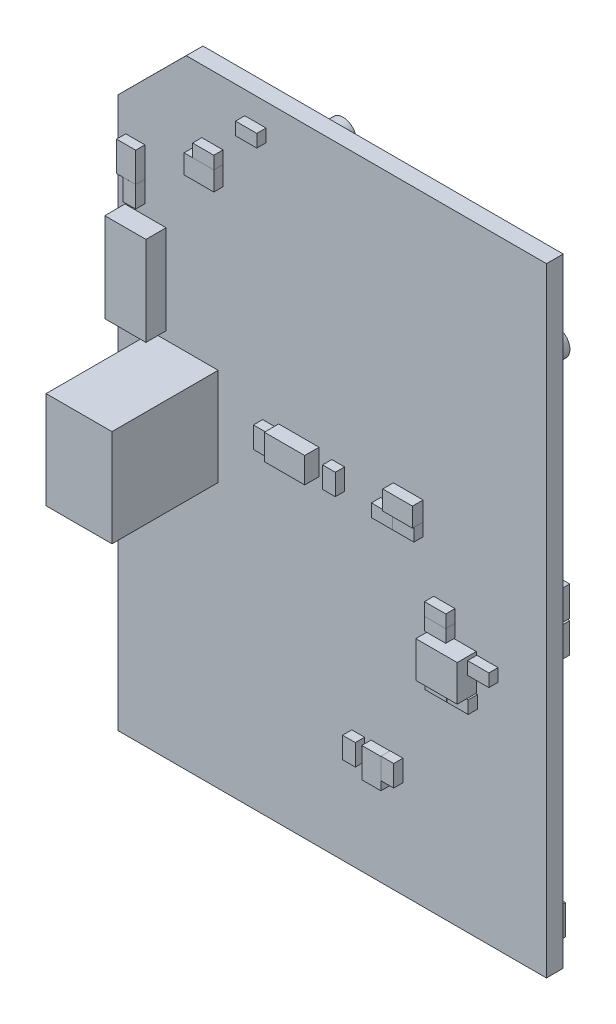
from build123d import *

# Parameters (mm, degrees)
BOARD_DEPTH            = 1.5748
ESQUISSE2_R            = 1.25
TMR16_1_DEPTH          = 2.5
ESQUISSE3_W            = 2.8
ESQUISSE3_H            = 1.8
EXTRUDE_C0603_1_DEPTH  = 0.87
ESQUISSE4_W            = 1.8
ESQUISSE4_H            = 2.8
EXTRUDE_R0603_1_DEPTH  = 0.87
ESQUISSE5_W            = 3.8
ESQUISSE5_H            = 2.4
EXTRUDE_C0805_1_DEPTH  = 1.35
ESQUISSE6_W            = 1.8
ESQUISSE6_H            = 2.8
EXTRUDE_R0603_2_DEPTH  = 0.87
ESQUISSE7_W            = 6.2
ESQUISSE7_H            = 9.15
B2B_PH_SM4_TB_1_DEPTH  = 10
ESQUISSE8_W            = 2.8
ESQUISSE8_H            = 1.8
EXTRUDE_C0603_2_DEPTH  = 0.87
ESQUISSE9_W            = 1.2
ESQUISSE9_H            = 2
EXTRUDE_C0402_1_DEPTH  = 0.87
ESQUISSE10_W           = 1.2
ESQUISSE10_H           = 2
EXTRUDE_C0402_2_DEPTH  = 0.87
ESQUISSE11_W           = 1.2
ESQUISSE11_H           = 2
EXTRUDE_C0402_3_DEPTH  = 0.87
ESQUISSE12_W           = 1.8
ESQUISSE12_H           = 2.8
EXTRUDE_R0603_3_DEPTH  = 0.87
ESQUISSE13_W           = 1.8
ESQUISSE13_H           = 2.8
EXTRUDE_R0603_4_DEPTH  = 0.87
ESQUISSE14_W           = 3.87388
ESQUISSE14_H           = 8.4
PCM12SMTR_1_DEPTH      = 1.9
ESQUISSE17_W           = 1.2
ESQUISSE17_H           = 2
EXTRUDE_C0402_4_DEPTH  = 0.87
ESQUISSE18_W           = 4.2
ESQUISSE18_H           = 2.5
FC135_1_DEPTH          = 0.8
ESQUISSE19_W           = 2.8
ESQUISSE19_H           = 1.8
EXTRUDE_C0603_3_DEPTH  = 0.87
ESQUISSE20_W           = 2
ESQUISSE20_H           = 1.2
EXTRUDE_C0402_5_DEPTH  = 0.87
ESQUISSE21_W           = 1.2
ESQUISSE21_H           = 2
EXTRUDE_R0402_1_DEPTH  = 0.87
ESQUISSE22_W           = 1.2
ESQUISSE22_H           = 2
EXTRUDE_R0402_2_DEPTH  = 0.87
ESQUISSE24_W           = 1.2
ESQUISSE24_H           = 2
EXTRUDE_C0402_6_DEPTH  = 0.87
ESQUISSE25_W           = 2
ESQUISSE25_H           = 1.2
EXTRUDE_C0402_7_DEPTH  = 0.87
ESQUISSE26_W           = 1.8
ESQUISSE26_H           = 2.8
EXTRUDE_C0603_4_DEPTH  = 0.87
ESQUISSE27_W           = 2
ESQUISSE27_H           = 1.2
EXTRUDE_C0402_8_DEPTH  = 0.87
ESQUISSE28_W           = 1.2
ESQUISSE28_H           = 2
EXTRUDE_C0402_9_DEPTH  = 0.87
ESQUISSE29_W           = 2.8
ESQUISSE29_H           = 1.8
EXTRUDE_R0603_5_DEPTH  = 0.87
ESQUISSE30_R           = 1.25
TMR16_2_DEPTH          = 2.5
ESQUISSE31_W           = 1.2
ESQUISSE31_H           = 2
EXTRUDE_C0402_10_DEPTH = 0.87
ESQUISSE33_W           = 2
ESQUISSE33_H           = 1.2
EXTRUDE_C0402_11_DEPTH = 0.87
ESQUISSE34_W           = 1.2
ESQUISSE34_H           = 2
EXTRUDE_C0402_12_DEPTH = 0.87
ESQUISSE36_W           = 1.2
ESQUISSE36_H           = 2
EXTRUDE_R0402_3_DEPTH  = 0.87
ESQUISSE37_W           = 1.2
ESQUISSE37_H           = 2
EXTRUDE_R0402_4_DEPTH  = 0.87
ESQUISSE38_W           = 2.8
ESQUISSE38_H           = 1.8
EXTRUDE_D0603_1_DEPTH  = 1
ESQUISSE39_W           = 1
ESQUISSE39_H           = 1
PAD_1X1_1_DEPTH        = 2.54
ESQUISSE40_W           = 2
ESQUISSE40_H           = 1.2
EXTRUDE_C0402_13_DEPTH = 0.87
ESQUISSE41_W           = 2
ESQUISSE41_H           = 1.2
EXTRUDE_R0402_5_DEPTH  = 0.87
ESQUISSE42_W           = 2
ESQUISSE42_H           = 1.2
EXTRUDE_C0402_14_DEPTH = 0.87
ESQUISSE43_W           = 1.2
ESQUISSE43_H           = 2
EXTRUDE_R0402_6_DEPTH  = 0.87
ESQUISSE44_W           = 1.8
ESQUISSE44_H           = 2.8
EXTRUDE_C0603_5_DEPTH  = 0.87
ESQUISSE45_W           = 2.8
ESQUISSE45_H           = 1.8
EXTRUDE_R0603_6_DEPTH  = 0.87
ESQUISSE46_W           = 2.8
ESQUISSE46_H           = 1.8
EXTRUDE_R0603_7_DEPTH  = 0.87
ESQUISSE47_W           = 1.2
ESQUISSE47_H           = 2
EXTRUDE_R0402_7_DEPTH  = 0.87
ESQUISSE48_W           = 1.8
ESQUISSE48_H           = 2.8
EXTRUDE_C0603_6_DEPTH  = 0.87
ESQUISSE49_W           = 1.8
ESQUISSE49_H           = 2.8
EXTRUDE_C0603_7_DEPTH  = 0.87
ESQUISSE52_W           = 1.8
ESQUISSE52_H           = 2.8
EXTRUDE_C0603_8_DEPTH  = 0.87
ESQUISSE53_W           = 1.2
ESQUISSE53_H           = 2
EXTRUDE_C0402_15_DEPTH = 0.87
ESQUISSE54_W           = 2
ESQUISSE54_H           = 1.2
EXTRUDE_C0402_16_DEPTH = 0.87
ESQUISSE55_W           = 3.9
ESQUISSE55_H           = 3.4
NX2520_1_DEPTH         = 1.8
ESQUISSE56_W           = 2
ESQUISSE56_H           = 1.2
EXTRUDE_C0402_17_DEPTH = 0.87
ESQUISSE57_W           = 1.8
ESQUISSE57_H           = 2.8
EXTRUDE_C0603_9_DEPTH  = 0.87
ESQUISSE59_W           = 1.2
ESQUISSE59_H           = 2
EXTRUDE_R0402_8_DEPTH  = 0.87
ESQUISSE60_W           = 1.2
ESQUISSE60_H           = 2
EXTRUDE_C0402_18_DEPTH = 0.87
ESQUISSE61_W           = 1.2
ESQUISSE61_H           = 2
EXTRUDE_C0402_19_DEPTH = 0.87
ESQUISSE63_W           = 2.8
ESQUISSE63_H           = 1.8
EXTRUDE_R0603_8_DEPTH  = 0.87
ESQUISSE64_W           = 2
ESQUISSE64_H           = 1.2
EXTRUDE_C0402_20_DEPTH = 0.87
ESQUISSE65_W           = 1.2
ESQUISSE65_H           = 2
EXTRUDE_R0402_9_DEPTH  = 0.87
ESQUISSE66_W           = 1.2
ESQUISSE66_H           = 2
EXTRUDE_R0402_10_DEPTH = 0.87
ESQUISSE69_W           = 1
ESQUISSE69_H           = 1
PAD_1X1_2_DEPTH        = 2.54
ESQUISSE70_W           = 1.8
ESQUISSE70_H           = 2.8
EXTRUDE_R0603_9_DEPTH  = 0.87
ESQUISSE72_W           = 2
ESQUISSE72_H           = 1.2
EXTRUDE_C0402_21_DEPTH = 0.87
ESQUISSE73_W           = 1.8
ESQUISSE73_H           = 2.8
EXTRUDE_C0603_10_DEPTH = 0.87
ESQUISSE74_W           = 1.2
ESQUISSE74_H           = 2
EXTRUDE_R0402_11_DEPTH = 0.87
ESQUISSE76_W           = 1.8
ESQUISSE76_H           = 2.8
EXTRUDE_C0603_11_DEPTH = 0.87
ESQUISSE77_W           = 2
ESQUISSE77_H           = 1.2
EXTRUDE_C0402_22_DEPTH = 0.87
ESQUISSE78_W           = 1.2
ESQUISSE78_H           = 2
EXTRUDE_C0402_23_DEPTH = 0.87
ESQUISSE80_W           = 2.8
ESQUISSE80_H           = 1.8
EXTRUDE_R0603_10_DEPTH = 0.87
ESQUISSE81_R           = 1.25
TMR16_3_DEPTH          = 2.5
ESQUISSE82_W           = 2
ESQUISSE82_H           = 1.2
EXTRUDE_C0402_24_DEPTH = 0.87
ESQUISSE85_W           = 1.2
ESQUISSE85_H           = 2
EXTRUDE_C0402_25_DEPTH = 0.87
ESQUISSE86_W           = 3.4
ESQUISSE86_H           = 3.9
NX2520_2_DEPTH         = 1.8
ESQUISSE88_W           = 1.8
ESQUISSE88_H           = 2.8
EXTRUDE_C0603_12_DEPTH = 0.87
ESQUISSE89_W           = 2.8
ESQUISSE89_H           = 1.8
EXTRUDE_R0603_11_DEPTH = 0.87
ESQUISSE90_W           = 2
ESQUISSE90_H           = 1.2
EXTRUDE_C0402_26_DEPTH = 0.87
ESQUISSE91_W           = 1.2
ESQUISSE91_H           = 2
EXTRUDE_C0402_27_DEPTH = 0.87
ESQUISSE92_W           = 2
ESQUISSE92_H           = 1.2
EXTRUDE_C0402_28_DEPTH = 0.87
ESQUISSE93_W           = 1.2
ESQUISSE93_H           = 2
EXTRUDE_R0402_12_DEPTH = 0.87
ESQUISSE94_W           = 1.2
ESQUISSE94_H           = 2
EXTRUDE_C0402_29_DEPTH = 0.87
ESQUISSE95_W           = 3.8
ESQUISSE95_H           = 2.4
EXTRUDE_C0805_2_DEPTH  = 1.35
ESQUISSE96_W           = 2.8
ESQUISSE96_H           = 1.8
EXTRUDE_R0603_12_DEPTH = 0.87
ESQUISSE97_W           = 1.2
ESQUISSE97_H           = 2
EXTRUDE_C0402_30_DEPTH = 0.87
ESQUISSE99_W           = 1.8
ESQUISSE99_H           = 2.8
EXTRUDE_D0603_2_DEPTH  = 1
ESQUISSE100_W          = 5.2
ESQUISSE100_H          = 3.6
F_2450AT18A100_1_DEPTH = 1.3
ESQUISSE101_W          = 1.2
ESQUISSE101_H          = 2
EXTRUDE_C0402_31_DEPTH = 0.87
ESQUISSE102_W          = 1.8
ESQUISSE102_H          = 2.8
EXTRUDE_R0603_13_DEPTH = 0.87
ESQUISSE104_R          = 1.25
TMR16_4_DEPTH          = 2.5
ESQUISSE105_W          = 1.2
ESQUISSE105_H          = 2
EXTRUDE_C0402_32_DEPTH = 0.87
ESQUISSE106_W          = 2.8
ESQUISSE106_H          = 1.8
EXTRUDE_C0603_13_DEPTH = 0.87
ESQUISSE107_W          = 2.4
ESQUISSE107_H          = 3.8
EXTRUDE_C0805_3_DEPTH  = 1.35
ESQUISSE108_W          = 1.2
ESQUISSE108_H          = 2
EXTRUDE_R0402_13_DEPTH = 0.87
ESQUISSE109_W          = 2
ESQUISSE109_H          = 1.2
EXTRUDE_R0402_14_DEPTH = 0.87
ESQUISSE110_W          = 1.2
ESQUISSE110_H          = 2
EXTRUDE_R0402_15_DEPTH = 0.87
ESQUISSE111_W          = 2
ESQUISSE111_H          = 1.2
EXTRUDE_R0402_16_DEPTH = 0.87
ESQUISSE114_W          = 2
ESQUISSE114_H          = 1.2
EXTRUDE_C0402_33_DEPTH = 0.87
ESQUISSE115_W          = 1.2
ESQUISSE115_H          = 2
EXTRUDE_C0402_34_DEPTH = 0.87
ESQUISSE116_W          = 1.8
ESQUISSE116_H          = 2.8
EXTRUDE_C0603_14_DEPTH = 0.87
ESQUISSE117_W          = 1.2
ESQUISSE117_H          = 2
EXTRUDE_C0402_35_DEPTH = 0.87
ESQUISSE118_R          = 1.25
TMR16_5_DEPTH          = 2.5
ESQUISSE119_W          = 2
ESQUISSE119_H          = 1.2
EXTRUDE_C0402_36_DEPTH = 0.87
ESQUISSE120_W          = 2.8
ESQUISSE120_H          = 1.8
EXTRUDE_C0603_15_DEPTH = 0.87
ESQUISSE122_W          = 1.2
ESQUISSE122_H          = 2
EXTRUDE_C0402_37_DEPTH = 0.87
ESQUISSE123_W          = 2
ESQUISSE123_H          = 1.2
EXTRUDE_C0402_38_DEPTH = 0.87
ESQUISSE124_W          = 2.8
ESQUISSE124_H          = 1.8
EXTRUDE_C0603_16_DEPTH = 0.87
ESQUISSE125_W          = 2
ESQUISSE125_H          = 1.2
EXTRUDE_C0402_39_DEPTH = 0.87
ESQUISSE126_W          = 1.2
ESQUISSE126_H          = 2
EXTRUDE_R0402_17_DEPTH = 0.87
ESQUISSE127_W          = 1.2
ESQUISSE127_H          = 2
EXTRUDE_C0402_40_DEPTH = 0.87
ESQUISSE128_R          = 1.25
TMR16_6_DEPTH          = 2.5
ESQUISSE129_W          = 2.8
ESQUISSE129_H          = 1.8
EXTRUDE_C0603_17_DEPTH = 0.87
ESQUISSE130_W          = 1.8
ESQUISSE130_H          = 2.8
EXTRUDE_C0603_18_DEPTH = 0.87
ESQUISSE131_W          = 1.8
ESQUISSE131_H          = 2.8
EXTRUDE_C0603_19_DEPTH = 0.87
ESQUISSE132_W          = 1.2
ESQUISSE132_H          = 2
EXTRUDE_R0402_18_DEPTH = 0.87
ESQUISSE133_W          = 1.2
ESQUISSE133_H          = 2
EXTRUDE_C0402_41_DEPTH = 0.87
ESQUISSE134_W          = 2
ESQUISSE134_H          = 1.2
EXTRUDE_C0402_42_DEPTH = 0.87
ESQUISSE135_W          = 1.8
ESQUISSE135_H          = 2.8
EXTRUDE_C0603_20_DEPTH = 0.87


with BuildPart() as part:
    # Esquisse1 → BOARD (new body)
    with BuildSketch(Plane.XY):
        Polygon((0, 0), (40.32, 0), (40.32, 58.24), (6.406017, 58.24), (0, 51.854002), align=None)
    extrude(amount=BOARD_DEPTH)


with BuildPart() as body_2:
    # Esquisse2 → TMR16-1 (new body)
    with BuildSketch(Plane.XY):
        with Locations((32.203899, 48.279009)):
            Circle(ESQUISSE2_R)
    extrude(amount=-TMR16_1_DEPTH)


with BuildPart() as body_3:
    # Esquisse3 → Extrude C0603-1 (new body)
    with BuildSketch(Plane.XY):
        with Locations((25.872733, 3.808157)):
            Rectangle(ESQUISSE3_W, ESQUISSE3_H)
    extrude(amount=-EXTRUDE_C0603_1_DEPTH)


with BuildPart() as body_4:
    # Esquisse4 → Extrude R0603-1 (new body)
    with BuildSketch(Plane.XY):
        with Locations((22.308877, 43.200925)):
            Rectangle(ESQUISSE4_W, ESQUISSE4_H)
    extrude(amount=-EXTRUDE_R0603_1_DEPTH)


with BuildPart() as body_5:
    # Esquisse5 → Extrude C0805-1 (new body)
    with BuildSketch(Plane.XY.offset(1.5748)):
        with Locations((17.009653, 31.367792)):
            Rectangle(ESQUISSE5_W, ESQUISSE5_H)
    extrude(amount=EXTRUDE_C0805_1_DEPTH)


with BuildPart() as body_6:
    # Esquisse6 → Extrude R0603-2 (new body)
    with BuildSketch(Plane.XY):
        with Locations((11.818698, 46.124731)):
            Rectangle(ESQUISSE6_W, ESQUISSE6_H)
    extrude(amount=-EXTRUDE_R0603_2_DEPTH)


with BuildPart() as body_7:
    # Esquisse7 → B2B-PH-SM4-TB-1 (new body)
    with BuildSketch(Plane.XY.offset(1.5748)):
        with Locations((6.316633, 29.518179)):
            Rectangle(ESQUISSE7_W, ESQUISSE7_H)
    extrude(amount=B2B_PH_SM4_TB_1_DEPTH)


with BuildPart() as body_8:
    # Esquisse8 → Extrude C0603-2 (new body)
    with BuildSketch(Plane.XY):
        with Locations((15.820005, 23.944537)):
            Rectangle(ESQUISSE8_W, ESQUISSE8_H)
    extrude(amount=-EXTRUDE_C0603_2_DEPTH)


with BuildPart() as body_9:
    # Esquisse9 → Extrude C0402-1 (new body)
    with BuildSketch(Plane.XY):
        with Locations((10.567667, 31.517398)):
            Rectangle(ESQUISSE9_W, ESQUISSE9_H)
    extrude(amount=-EXTRUDE_C0402_1_DEPTH)


with BuildPart() as body_10:
    # Esquisse10 → Extrude C0402-2 (new body)
    with BuildSketch(Plane.XY):
        with Locations((17.425858, 35.779411)):
            Rectangle(ESQUISSE10_W, ESQUISSE10_H)
    extrude(amount=-EXTRUDE_C0402_2_DEPTH)


with BuildPart() as body_11:
    # Esquisse11 → Extrude C0402-3 (new body)
    with BuildSketch(Plane.XY):
        with Locations((35.91324, 2.568952)):
            Rectangle(ESQUISSE11_W, ESQUISSE11_H)
    extrude(amount=-EXTRUDE_C0402_3_DEPTH)


with BuildPart() as body_12:
    # Esquisse12 → Extrude R0603-3 (new body)
    with BuildSketch(Plane.XY):
        with Locations((32.06017, 40.523841)):
            Rectangle(ESQUISSE12_W, ESQUISSE12_H)
    extrude(amount=-EXTRUDE_R0603_3_DEPTH)


with BuildPart() as body_13:
    # Esquisse13 → Extrude R0603-4 (new body)
    with BuildSketch(Plane.XY):
        with Locations((22.312589, 46.000927)):
            Rectangle(ESQUISSE13_W, ESQUISSE13_H)
    extrude(amount=-EXTRUDE_R0603_4_DEPTH)


with BuildPart() as body_14:
    # Esquisse14 → PCM12SMTR-1 (new body)
    with BuildSketch(Plane.XY.offset(1.5748)):
        with Locations((2.576941, 39.06309)):
            Rectangle(ESQUISSE14_W, ESQUISSE14_H)
    extrude(amount=PCM12SMTR_1_DEPTH)


with BuildPart() as body_15:
    # Esquisse17 → Extrude C0402-4 (new body)
    with BuildSketch(Plane.XY):
        with Locations((25.793902, 25.762908)):
            Rectangle(ESQUISSE17_W, ESQUISSE17_H)
    extrude(amount=-EXTRUDE_C0402_4_DEPTH)


with BuildPart() as body_16:
    # Esquisse18 → FC135-1 (new body)
    with BuildSketch(Plane.XY):
        with Locations((33.240935, 10.027865)):
            Rectangle(ESQUISSE18_W, ESQUISSE18_H)
    extrude(amount=-FC135_1_DEPTH)


with BuildPart() as body_17:
    # Esquisse19 → Extrude C0603-3 (new body)
    with BuildSketch(Plane.XY):
        with Locations((36.432325, 20.123892)):
            Rectangle(ESQUISSE19_W, ESQUISSE19_H)
    extrude(amount=-EXTRUDE_C0603_3_DEPTH)


with BuildPart() as body_18:
    # Esquisse20 → Extrude C0402-5 (new body)
    with BuildSketch(Plane.XY.offset(1.5748)):
        with Locations((32.824655, 19.265021)):
            Rectangle(ESQUISSE20_W, ESQUISSE20_H)
    extrude(amount=EXTRUDE_C0402_5_DEPTH)


with BuildPart() as body_19:
    # Esquisse21 → Extrude R0402-1 (new body)
    with BuildSketch(Plane.XY):
        with Locations((15.814417, 18.927961)):
            Rectangle(ESQUISSE21_W, ESQUISSE21_H)
    extrude(amount=-EXTRUDE_R0402_1_DEPTH)


with BuildPart() as body_20:
    # Esquisse22 → Extrude R0402-2 (new body)
    with BuildSketch(Plane.XY.offset(1.5748)):
        with Locations((22.593849, 10.066965)):
            Rectangle(ESQUISSE22_W, ESQUISSE22_H)
    extrude(amount=EXTRUDE_R0402_2_DEPTH)


with BuildPart() as body_21:
    # Esquisse24 → Extrude C0402-6 (new body)
    with BuildSketch(Plane.XY):
        with Locations((16.228394, 25.861712)):
            Rectangle(ESQUISSE24_W, ESQUISSE24_H)
    extrude(amount=-EXTRUDE_C0402_6_DEPTH)


with BuildPart() as body_22:
    # Esquisse25 → Extrude C0402-7 (new body)
    with BuildSketch(Plane.XY.offset(1.5748)):
        with Locations((30.771754, 19.261943)):
            Rectangle(ESQUISSE25_W, ESQUISSE25_H)
    extrude(amount=EXTRUDE_C0402_7_DEPTH)


with BuildPart() as body_23:
    # Esquisse26 → Extrude C0603-4 (new body)
    with BuildSketch(Plane.XY):
        with Locations((24.2939, 25.365786)):
            Rectangle(ESQUISSE26_W, ESQUISSE26_H)
    extrude(amount=-EXTRUDE_C0603_4_DEPTH)


with BuildPart() as body_24:
    # Esquisse27 → Extrude C0402-8 (new body)
    with BuildSketch(Plane.XY.offset(1.5748)):
        with Locations((8.873394, 51.690244)):
            Rectangle(ESQUISSE27_W, ESQUISSE27_H)
    extrude(amount=EXTRUDE_C0402_8_DEPTH)


with BuildPart() as body_25:
    # Esquisse28 → Extrude C0402-9 (new body)
    with BuildSketch(Plane.XY):
        with Locations((30.540933, 9.781641)):
            Rectangle(ESQUISSE28_W, ESQUISSE28_H)
    extrude(amount=-EXTRUDE_C0402_9_DEPTH)


with BuildPart() as body_26:
    # Esquisse29 → Extrude R0603-5 (new body)
    with BuildSketch(Plane.XY):
        with Locations((31.653163, 33.031514)):
            Rectangle(ESQUISSE29_W, ESQUISSE29_H)
    extrude(amount=-EXTRUDE_R0603_5_DEPTH)


with BuildPart() as body_27:
    # Esquisse30 → TMR16-2 (new body)
    with BuildSketch(Plane.XY):
        with Locations((37.201537, 48.275326)):
            Circle(ESQUISSE30_R)
    extrude(amount=-TMR16_2_DEPTH)


with BuildPart() as body_28:
    # Esquisse31 → Extrude C0402-10 (new body)
    with BuildSketch(Plane.XY):
        with Locations((30.865996, 28.678907)):
            Rectangle(ESQUISSE31_W, ESQUISSE31_H)
    extrude(amount=-EXTRUDE_C0402_10_DEPTH)


with BuildPart() as body_29:
    # Esquisse33 → Extrude C0402-11 (new body)
    with BuildSketch(Plane.XY):
        with Locations((34.143554, 11.881774)):
            Rectangle(ESQUISSE33_W, ESQUISSE33_H)
    extrude(amount=-EXTRUDE_C0402_11_DEPTH)


with BuildPart() as body_30:
    # Esquisse34 → Extrude C0402-12 (new body)
    with BuildSketch(Plane.XY):
        with Locations((38.070298, 41.659809)):
            Rectangle(ESQUISSE34_W, ESQUISSE34_H)
    extrude(amount=-EXTRUDE_C0402_12_DEPTH)


with BuildPart() as body_31:
    # Esquisse36 → Extrude R0402-3 (new body)
    with BuildSketch(Plane.XY):
        with Locations((38.060173, 37.299502)):
            Rectangle(ESQUISSE36_W, ESQUISSE36_H)
    extrude(amount=-EXTRUDE_R0402_3_DEPTH)


with BuildPart() as body_32:
    # Esquisse37 → Extrude R0402-4 (new body)
    with BuildSketch(Plane.XY):
        with Locations((22.603602, 39.9713)):
            Rectangle(ESQUISSE37_W, ESQUISSE37_H)
    extrude(amount=-EXTRUDE_R0402_4_DEPTH)


with BuildPart() as body_33:
    # Esquisse38 → Extrude D0603-1 (new body)
    with BuildSketch(Plane.XY.offset(1.5748)):
        with Locations((27.307001, 32.265109)):
            Rectangle(ESQUISSE38_W, ESQUISSE38_H)
    extrude(amount=EXTRUDE_D0603_1_DEPTH)


with BuildPart() as body_34:
    # Esquisse39 → PAD_1x1-1 (new body)
    with BuildSketch(Plane.XY):
        with Locations((33.868341, 1.152304)):
            Rectangle(ESQUISSE39_W, ESQUISSE39_H)
    extrude(amount=-PAD_1X1_1_DEPTH)


with BuildPart() as body_35:
    # Esquisse40 → Extrude C0402-13 (new body)
    with BuildSketch(Plane.XY.offset(1.5748)):
        with Locations((34.763577, 22.430815)):
            Rectangle(ESQUISSE40_W, ESQUISSE40_H)
    extrude(amount=EXTRUDE_C0402_13_DEPTH)


with BuildPart() as body_36:
    # Esquisse41 → Extrude R0402-5 (new body)
    with BuildSketch(Plane.XY.offset(1.5748)):
        with Locations((27.706936, 30.765107)):
            Rectangle(ESQUISSE41_W, ESQUISSE41_H)
    extrude(amount=EXTRUDE_R0402_5_DEPTH)


with BuildPart() as body_37:
    # Esquisse42 → Extrude C0402-14 (new body)
    with BuildSketch(Plane.XY.offset(1.5748)):
        with Locations((30.709924, 24.014286)):
            Rectangle(ESQUISSE42_W, ESQUISSE42_H)
    extrude(amount=EXTRUDE_C0402_14_DEPTH)


with BuildPart() as body_38:
    # Esquisse43 → Extrude R0402-6 (new body)
    with BuildSketch(Plane.XY):
        with Locations((17.828825, 46.590972)):
            Rectangle(ESQUISSE43_W, ESQUISSE43_H)
    extrude(amount=-EXTRUDE_R0402_6_DEPTH)


with BuildPart() as body_39:
    # Esquisse44 → Extrude C0603-5 (new body)
    with BuildSketch(Plane.XY.offset(1.5748)):
        with Locations((1.620324, 47.62432)):
            Rectangle(ESQUISSE44_W, ESQUISSE44_H)
    extrude(amount=EXTRUDE_C0603_5_DEPTH)


with BuildPart() as body_40:
    # Esquisse45 → Extrude R0603-6 (new body)
    with BuildSketch(Plane.XY):
        with Locations((24.697694, 35.091264)):
            Rectangle(ESQUISSE45_W, ESQUISSE45_H)
    extrude(amount=-EXTRUDE_R0603_6_DEPTH)


with BuildPart() as body_41:
    # Esquisse46 → Extrude R0603-7 (new body)
    with BuildSketch(Plane.XY):
        with Locations((11.460749, 35.855593)):
            Rectangle(ESQUISSE46_W, ESQUISSE46_H)
    extrude(amount=-EXTRUDE_R0603_7_DEPTH)


with BuildPart() as body_42:
    # Esquisse47 → Extrude R0402-7 (new body)
    with BuildSketch(Plane.XY):
        with Locations((28.316675, 39.973481)):
            Rectangle(ESQUISSE47_W, ESQUISSE47_H)
    extrude(amount=-EXTRUDE_R0402_7_DEPTH)


with BuildPart() as body_43:
    # Esquisse48 → Extrude C0603-6 (new body)
    with BuildSketch(Plane.XY):
        with Locations((29.35816, 29.121407)):
            Rectangle(ESQUISSE48_W, ESQUISSE48_H)
    extrude(amount=-EXTRUDE_C0603_6_DEPTH)


with BuildPart() as body_44:
    # Esquisse49 → Extrude C0603-7 (new body)
    with BuildSketch(Plane.XY):
        with Locations((19.248644, 52.630308)):
            Rectangle(ESQUISSE49_W, ESQUISSE49_H)
    extrude(amount=-EXTRUDE_C0603_7_DEPTH)


with BuildPart() as body_45:
    # Esquisse52 → Extrude C0603-8 (new body)
    with BuildSketch(Plane.XY):
        with Locations((29.353162, 31.921408)):
            Rectangle(ESQUISSE52_W, ESQUISSE52_H)
    extrude(amount=-EXTRUDE_C0603_8_DEPTH)


with BuildPart() as body_46:
    # Esquisse53 → Extrude C0402-15 (new body)
    with BuildSketch(Plane.XY):
        with Locations((12.041463, 14.141907)):
            Rectangle(ESQUISSE53_W, ESQUISSE53_H)
    extrude(amount=-EXTRUDE_C0402_15_DEPTH)


with BuildPart() as body_47:
    # Esquisse54 → Extrude C0402-16 (new body)
    with BuildSketch(Plane.XY):
        with Locations((15.42801, 17.21035)):
            Rectangle(ESQUISSE54_W, ESQUISSE54_H)
    extrude(amount=-EXTRUDE_C0402_16_DEPTH)


with BuildPart() as body_48:
    # Esquisse55 → NX2520-1 (new body)
    with BuildSketch(Plane.XY.offset(1.5748)):
        with Locations((31.766351, 21.616905)):
            Rectangle(ESQUISSE55_W, ESQUISSE55_H)
    extrude(amount=NX2520_1_DEPTH)


with BuildPart() as body_49:
    # Esquisse56 → Extrude C0402-17 (new body)
    with BuildSketch(Plane.XY):
        with Locations((36.678574, 22.199559)):
            Rectangle(ESQUISSE56_W, ESQUISSE56_H)
    extrude(amount=-EXTRUDE_C0402_17_DEPTH)


with BuildPart() as body_50:
    # Esquisse57 → Extrude C0603-9 (new body)
    with BuildSketch(Plane.XY):
        with Locations((18.867669, 29.214419)):
            Rectangle(ESQUISSE57_W, ESQUISSE57_H)
    extrude(amount=-EXTRUDE_C0603_9_DEPTH)


with BuildPart() as body_51:
    # Esquisse59 → Extrude R0402-8 (new body)
    with BuildSketch(Plane.XY):
        with Locations((17.823299, 40.07917)):
            Rectangle(ESQUISSE59_W, ESQUISSE59_H)
    extrude(amount=-EXTRUDE_R0402_8_DEPTH)


with BuildPart() as body_52:
    # Esquisse60 → Extrude C0402-18 (new body)
    with BuildSketch(Plane.XY):
        with Locations((27.90338, 35.613672)):
            Rectangle(ESQUISSE60_W, ESQUISSE60_H)
    extrude(amount=-EXTRUDE_C0402_18_DEPTH)


with BuildPart() as body_53:
    # Esquisse61 → Extrude C0402-19 (new body)
    with BuildSketch(Plane.XY):
        with Locations((27.892229, 3.251345)):
            Rectangle(ESQUISSE61_W, ESQUISSE61_H)
    extrude(amount=-EXTRUDE_C0402_19_DEPTH)


with BuildPart() as body_54:
    # Esquisse63 → Extrude R0603-8 (new body)
    with BuildSketch(Plane.XY):
        with Locations((14.270408, 35.223003)):
            Rectangle(ESQUISSE63_W, ESQUISSE63_H)
    extrude(amount=-EXTRUDE_R0603_8_DEPTH)


with BuildPart() as body_55:
    # Esquisse64 → Extrude C0402-20 (new body)
    with BuildSketch(Plane.XY):
        with Locations((19.020116, 20.76161)):
            Rectangle(ESQUISSE64_W, ESQUISSE64_H)
    extrude(amount=-EXTRUDE_C0402_20_DEPTH)


with BuildPart() as body_56:
    # Esquisse65 → Extrude R0402-9 (new body)
    with BuildSketch(Plane.XY.offset(1.5748)):
        with Locations((20.712614, 31.165191)):
            Rectangle(ESQUISSE65_W, ESQUISSE65_H)
    extrude(amount=EXTRUDE_R0402_9_DEPTH)


with BuildPart() as body_57:
    # Esquisse66 → Extrude R0402-10 (new body)
    with BuildSketch(Plane.XY):
        with Locations((38.071728, 43.659811)):
            Rectangle(ESQUISSE66_W, ESQUISSE66_H)
    extrude(amount=-EXTRUDE_R0402_10_DEPTH)


with BuildPart() as body_58:
    # Esquisse69 → PAD_1x1-2 (new body)
    with BuildSketch(Plane.XY):
        with Locations((32.487653, 1.140001)):
            Rectangle(ESQUISSE69_W, ESQUISSE69_H)
    extrude(amount=-PAD_1X1_2_DEPTH)


with BuildPart() as body_59:
    # Esquisse70 → Extrude R0603-9 (new body)
    with BuildSketch(Plane.XY):
        with Locations((32.06017, 43.323843)):
            Rectangle(ESQUISSE70_W, ESQUISSE70_H)
    extrude(amount=-EXTRUDE_R0603_9_DEPTH)


with BuildPart() as body_60:
    # Esquisse72 → Extrude C0402-21 (new body)
    with BuildSketch(Plane.XY):
        with Locations((36.689748, 23.424667)):
            Rectangle(ESQUISSE72_W, ESQUISSE72_H)
    extrude(amount=-EXTRUDE_C0402_21_DEPTH)


with BuildPart() as body_61:
    # Esquisse73 → Extrude C0603-10 (new body)
    with BuildSketch(Plane.XY):
        with Locations((39.165999, 29.378558)):
            Rectangle(ESQUISSE73_W, ESQUISSE73_H)
    extrude(amount=-EXTRUDE_C0603_10_DEPTH)


with BuildPart() as body_62:
    # Esquisse74 → Extrude R0402-11 (new body)
    with BuildSketch(Plane.XY):
        with Locations((35.920084, 4.676423)):
            Rectangle(ESQUISSE74_W, ESQUISSE74_H)
    extrude(amount=-EXTRUDE_R0402_11_DEPTH)


with BuildPart() as body_63:
    # Esquisse76 → Extrude C0603-11 (new body)
    with BuildSketch(Plane.XY):
        with Locations((39.165999, 26.380488)):
            Rectangle(ESQUISSE76_W, ESQUISSE76_H)
    extrude(amount=-EXTRUDE_C0603_11_DEPTH)


with BuildPart() as body_64:
    # Esquisse77 → Extrude C0402-22 (new body)
    with BuildSketch(Plane.XY):
        with Locations((11.718698, 48.124732)):
            Rectangle(ESQUISSE77_W, ESQUISSE77_H)
    extrude(amount=-EXTRUDE_C0402_22_DEPTH)


with BuildPart() as body_65:
    # Esquisse78 → Extrude C0402-23 (new body)
    with BuildSketch(Plane.XY):
        with Locations((17.828825, 44.590971)):
            Rectangle(ESQUISSE78_W, ESQUISSE78_H)
    extrude(amount=-EXTRUDE_C0402_23_DEPTH)


with BuildPart() as body_66:
    # Esquisse80 → Extrude R0603-10 (new body)
    with BuildSketch(Plane.XY):
        with Locations((37.936908, 5.38343)):
            Rectangle(ESQUISSE80_W, ESQUISSE80_H)
    extrude(amount=-EXTRUDE_R0603_10_DEPTH)


with BuildPart() as body_67:
    # Esquisse81 → TMR16-3 (new body)
    with BuildSketch(Plane.XY):
        with Locations((17.098643, 50.277012)):
            Circle(ESQUISSE81_R)
    extrude(amount=-TMR16_3_DEPTH)


with BuildPart() as body_68:
    # Esquisse82 → Extrude C0402-24 (new body)
    with BuildSketch(Plane.XY):
        with Locations((27.513236, 7.531219)):
            Rectangle(ESQUISSE82_W, ESQUISSE82_H)
    extrude(amount=-EXTRUDE_C0402_24_DEPTH)


with BuildPart() as body_69:
    # Esquisse85 → Extrude C0402-25 (new body)
    with BuildSketch(Plane.XY.offset(1.5748)):
        with Locations((26.208014, 10.165104)):
            Rectangle(ESQUISSE85_W, ESQUISSE85_H)
    extrude(amount=EXTRUDE_C0402_25_DEPTH)


with BuildPart() as body_70:
    # Esquisse86 → NX2520-2 (new body)
    with BuildSketch(Plane.XY):
        with Locations((28.058085, 10.772102)):
            Rectangle(ESQUISSE86_W, ESQUISSE86_H)
    extrude(amount=-NX2520_2_DEPTH)


with BuildPart() as body_71:
    # Esquisse88 → Extrude C0603-12 (new body)
    with BuildSketch(Plane.XY):
        with Locations((23.667681, 18.761675)):
            Rectangle(ESQUISSE88_W, ESQUISSE88_H)
    extrude(amount=-EXTRUDE_C0603_12_DEPTH)


with BuildPart() as body_72:
    # Esquisse89 → Extrude R0603-11 (new body)
    with BuildSketch(Plane.XY):
        with Locations((34.453164, 32.422076)):
            Rectangle(ESQUISSE89_W, ESQUISSE89_H)
    extrude(amount=-EXTRUDE_R0603_11_DEPTH)


with BuildPart() as body_73:
    # Esquisse90 → Extrude C0402-26 (new body)
    with BuildSketch(Plane.XY):
        with Locations((22.211403, 48.000929)):
            Rectangle(ESQUISSE90_W, ESQUISSE90_H)
    extrude(amount=-EXTRUDE_C0402_26_DEPTH)


with BuildPart() as body_74:
    # Esquisse91 → Extrude C0402-27 (new body)
    with BuildSketch(Plane.XY):
        with Locations((30.39042, 12.576262)):
            Rectangle(ESQUISSE91_W, ESQUISSE91_H)
    extrude(amount=-EXTRUDE_C0402_27_DEPTH)


with BuildPart() as body_75:
    # Esquisse92 → Extrude C0402-28 (new body)
    with BuildSketch(Plane.XY.offset(1.5748)):
        with Locations((25.705236, 30.765107)):
            Rectangle(ESQUISSE92_W, ESQUISSE92_H)
    extrude(amount=EXTRUDE_C0402_28_DEPTH)


with BuildPart() as body_76:
    # Esquisse93 → Extrude R0402-12 (new body)
    with BuildSketch(Plane.XY):
        with Locations((22.793898, 25.76056)):
            Rectangle(ESQUISSE93_W, ESQUISSE93_H)
    extrude(amount=-EXTRUDE_R0402_12_DEPTH)


with BuildPart() as body_77:
    # Esquisse94 → Extrude C0402-29 (new body)
    with BuildSketch(Plane.XY):
        with Locations((28.313841, 44.487037)):
            Rectangle(ESQUISSE94_W, ESQUISSE94_H)
    extrude(amount=-EXTRUDE_C0402_29_DEPTH)


with BuildPart() as body_78:
    # Esquisse95 → Extrude C0805-2 (new body)
    with BuildSketch(Plane.XY):
        with Locations((8.799525, 15.647155)):
            Rectangle(ESQUISSE95_W, ESQUISSE95_H)
    extrude(amount=-EXTRUDE_C0805_2_DEPTH)


with BuildPart() as body_79:
    # Esquisse96 → Extrude R0603-12 (new body)
    with BuildSketch(Plane.XY):
        with Locations((21.891445, 35.687368)):
            Rectangle(ESQUISSE96_W, ESQUISSE96_H)
    extrude(amount=-EXTRUDE_R0603_12_DEPTH)


with BuildPart() as body_80:
    # Esquisse97 → Extrude C0402-30 (new body)
    with BuildSketch(Plane.XY):
        with Locations((22.588542, 1.8155)):
            Rectangle(ESQUISSE97_W, ESQUISSE97_H)
    extrude(amount=-EXTRUDE_C0402_30_DEPTH)


with BuildPart() as body_81:
    # Esquisse99 → Extrude D0603-2 (new body)
    with BuildSketch(Plane.XY):
        with Locations((38.644558, 3.071961)):
            Rectangle(ESQUISSE99_W, ESQUISSE99_H)
    extrude(amount=-EXTRUDE_D0603_2_DEPTH)


with BuildPart() as body_82:
    # Esquisse100 → 2450AT18A100-1 (new body)
    with BuildSketch(Plane.XY):
        with Locations((2.854001, 2.054001)):
            Rectangle(ESQUISSE100_W, ESQUISSE100_H)
    extrude(amount=-F_2450AT18A100_1_DEPTH)


with BuildPart() as body_83:
    # Esquisse101 → Extrude C0402-31 (new body)
    with BuildSketch(Plane.XY.offset(1.5748)):
        with Locations((14.207692, 31.167791)):
            Rectangle(ESQUISSE101_W, ESQUISSE101_H)
    extrude(amount=EXTRUDE_C0402_31_DEPTH)


with BuildPart() as body_84:
    # Esquisse102 → Extrude R0603-13 (new body)
    with BuildSketch(Plane.XY):
        with Locations((11.818698, 43.32473)):
            Rectangle(ESQUISSE102_W, ESQUISSE102_H)
    extrude(amount=-EXTRUDE_R0603_13_DEPTH)


with BuildPart() as body_85:
    # Esquisse104 → TMR16-4 (new body)
    with BuildSketch(Plane.XY):
        with Locations((17.10151, 55.280309)):
            Circle(ESQUISSE104_R)
    extrude(amount=-TMR16_4_DEPTH)


with BuildPart() as body_86:
    # Esquisse105 → Extrude C0402-32 (new body)
    with BuildSketch(Plane.XY):
        with Locations((15.028392, 25.862882)):
            Rectangle(ESQUISSE105_W, ESQUISSE105_H)
    extrude(amount=-EXTRUDE_C0402_32_DEPTH)


with BuildPart() as body_87:
    # Esquisse106 → Extrude C0603-13 (new body)
    with BuildSketch(Plane.XY):
        with Locations((24.759417, 50.785136)):
            Rectangle(ESQUISSE106_W, ESQUISSE106_H)
    extrude(amount=-EXTRUDE_C0603_13_DEPTH)


with BuildPart() as body_88:
    # Esquisse107 → Extrude C0805-3 (new body)
    with BuildSketch(Plane.XY):
        with Locations((36.540937, 10.127076)):
            Rectangle(ESQUISSE107_W, ESQUISSE107_H)
    extrude(amount=-EXTRUDE_C0805_3_DEPTH)


with BuildPart() as body_89:
    # Esquisse108 → Extrude R0402-13 (new body)
    with BuildSketch(Plane.XY):
        with Locations((12.118698, 40.08317)):
            Rectangle(ESQUISSE108_W, ESQUISSE108_H)
    extrude(amount=-EXTRUDE_R0402_13_DEPTH)


with BuildPart() as body_90:
    # Esquisse109 → Extrude R0402-14 (new body)
    with BuildSketch(Plane.XY):
        with Locations((33.468193, 19.759628)):
            Rectangle(ESQUISSE109_W, ESQUISSE109_H)
    extrude(amount=-EXTRUDE_R0402_14_DEPTH)


with BuildPart() as body_91:
    # Esquisse110 → Extrude R0402-15 (new body)
    with BuildSketch(Plane.XY):
        with Locations((28.323964, 46.487039)):
            Rectangle(ESQUISSE110_W, ESQUISSE110_H)
    extrude(amount=-EXTRUDE_R0402_15_DEPTH)


with BuildPart() as body_92:
    # Esquisse111 → Extrude R0402-16 (new body)
    with BuildSketch(Plane.XY):
        with Locations((16.532767, 21.773414)):
            Rectangle(ESQUISSE111_W, ESQUISSE111_H)
    extrude(amount=-EXTRUDE_R0402_16_DEPTH)


with BuildPart() as body_93:
    # Esquisse114 → Extrude C0402-33 (new body)
    with BuildSketch(Plane.XY.offset(1.5748)):
        with Locations((30.709924, 25.214287)):
            Rectangle(ESQUISSE114_W, ESQUISSE114_H)
    extrude(amount=EXTRUDE_C0402_33_DEPTH)


with BuildPart() as body_94:
    # Esquisse115 → Extrude C0402-34 (new body)
    with BuildSketch(Plane.XY):
        with Locations((25.698811, 9.426021)):
            Rectangle(ESQUISSE115_W, ESQUISSE115_H)
    extrude(amount=-EXTRUDE_C0402_34_DEPTH)


with BuildPart() as body_95:
    # Esquisse116 → Extrude C0603-14 (new body)
    with BuildSketch(Plane.XY):
        with Locations((34.60896, 47.324684)):
            Rectangle(ESQUISSE116_W, ESQUISSE116_H)
    extrude(amount=-EXTRUDE_C0603_14_DEPTH)


with BuildPart() as body_96:
    # Esquisse117 → Extrude C0402-35 (new body)
    with BuildSketch(Plane.XY.offset(1.5748)):
        with Locations((1.920324, 45.224006)):
            Rectangle(ESQUISSE117_W, ESQUISSE117_H)
    extrude(amount=EXTRUDE_C0402_35_DEPTH)


with BuildPart() as body_97:
    # Esquisse118 → TMR16-5 (new body)
    with BuildSketch(Plane.XY):
        with Locations((27.254182, 52.906916)):
            Circle(ESQUISSE118_R)
    extrude(amount=-TMR16_5_DEPTH)


with BuildPart() as body_98:
    # Esquisse119 → Extrude C0402-36 (new body)
    with BuildSketch(Plane.XY.offset(1.5748)):
        with Locations((12.921552, 55.497622)):
            Rectangle(ESQUISSE119_W, ESQUISSE119_H)
    extrude(amount=EXTRUDE_C0402_36_DEPTH)


with BuildPart() as body_99:
    # Esquisse120 → Extrude C0603-15 (new body)
    with BuildSketch(Plane.XY):
        with Locations((12.985613, 24.843605)):
            Rectangle(ESQUISSE120_W, ESQUISSE120_H)
    extrude(amount=-EXTRUDE_C0603_15_DEPTH)


with BuildPart() as body_100:
    # Esquisse122 → Extrude C0402-37 (new body)
    with BuildSketch(Plane.XY):
        with Locations((37.661682, 32.950426)):
            Rectangle(ESQUISSE122_W, ESQUISSE122_H)
    extrude(amount=-EXTRUDE_C0402_37_DEPTH)


with BuildPart() as body_101:
    # Esquisse123 → Extrude C0402-38 (new body)
    with BuildSketch(Plane.XY):
        with Locations((32.139716, 11.877956)):
            Rectangle(ESQUISSE123_W, ESQUISSE123_H)
    extrude(amount=-EXTRUDE_C0402_38_DEPTH)


with BuildPart() as body_102:
    # Esquisse124 → Extrude C0603-16 (new body)
    with BuildSketch(Plane.XY.offset(1.5748)):
        with Locations((8.474136, 50.190243)):
            Rectangle(ESQUISSE124_W, ESQUISSE124_H)
    extrude(amount=EXTRUDE_C0603_16_DEPTH)


with BuildPart() as body_103:
    # Esquisse125 → Extrude C0402-39 (new body)
    with BuildSketch(Plane.XY):
        with Locations((36.339139, 7.60978)):
            Rectangle(ESQUISSE125_W, ESQUISSE125_H)
    extrude(amount=-EXTRUDE_C0402_39_DEPTH)


with BuildPart() as body_104:
    # Esquisse126 → Extrude R0402-17 (new body)
    with BuildSketch(Plane.XY):
        with Locations((32.360171, 37.286382)):
            Rectangle(ESQUISSE126_W, ESQUISSE126_H)
    extrude(amount=-EXTRUDE_R0402_17_DEPTH)


with BuildPart() as body_105:
    # Esquisse127 → Extrude C0402-40 (new body)
    with BuildSketch(Plane.XY):
        with Locations((26.993904, 25.76793)):
            Rectangle(ESQUISSE127_W, ESQUISSE127_H)
    extrude(amount=-EXTRUDE_C0402_40_DEPTH)


with BuildPart() as body_106:
    # Esquisse128 → TMR16-6 (new body)
    with BuildSketch(Plane.XY):
        with Locations((22.255596, 52.903519)):
            Circle(ESQUISSE128_R)
    extrude(amount=-TMR16_6_DEPTH)


with BuildPart() as body_107:
    # Esquisse129 → Extrude C0603-17 (new body)
    with BuildSketch(Plane.XY):
        with Locations((26.593901, 23.862907)):
            Rectangle(ESQUISSE129_W, ESQUISSE129_H)
    extrude(amount=-EXTRUDE_C0603_17_DEPTH)


with BuildPart() as body_108:
    # Esquisse130 → Extrude C0603-18 (new body)
    with BuildSketch(Plane.XY.offset(1.5748)):
        with Locations((24.704986, 9.739659)):
            Rectangle(ESQUISSE130_W, ESQUISSE130_H)
    extrude(amount=EXTRUDE_C0603_18_DEPTH)


with BuildPart() as body_109:
    # Esquisse131 → Extrude C0603-19 (new body)
    with BuildSketch(Plane.XY):
        with Locations((18.867669, 32.220028)):
            Rectangle(ESQUISSE131_W, ESQUISSE131_H)
    extrude(amount=-EXTRUDE_C0603_19_DEPTH)


with BuildPart() as body_110:
    # Esquisse132 → Extrude R0402-18 (new body)
    with BuildSketch(Plane.XY):
        with Locations((37.137007, 3.069218)):
            Rectangle(ESQUISSE132_W, ESQUISSE132_H)
    extrude(amount=-EXTRUDE_R0402_18_DEPTH)


with BuildPart() as body_111:
    # Esquisse133 → Extrude C0402-41 (new body)
    with BuildSketch(Plane.XY):
        with Locations((21.053158, 30.933955)):
            Rectangle(ESQUISSE133_W, ESQUISSE133_H)
    extrude(amount=-EXTRUDE_C0402_41_DEPTH)


with BuildPart() as body_112:
    # Esquisse134 → Extrude C0402-42 (new body)
    with BuildSketch(Plane.XY):
        with Locations((31.96017, 45.323848)):
            Rectangle(ESQUISSE134_W, ESQUISSE134_H)
    extrude(amount=-EXTRUDE_C0402_42_DEPTH)


with BuildPart() as body_113:
    # Esquisse135 → Extrude C0603-20 (new body)
    with BuildSketch(Plane.XY):
        with Locations((33.905608, 21.819979)):
            Rectangle(ESQUISSE135_W, ESQUISSE135_H)
    extrude(amount=-EXTRUDE_C0603_20_DEPTH)


solid = Compound([part.part, body_2.part, body_3.part, body_4.part, body_5.part, body_6.part, body_7.part, body_8.part, body_9.part, body_10.part, body_11.part, body_12.part, body_13.part, body_14.part, body_15.part, body_16.part, body_17.part, body_18.part, body_19.part, body_20.part, body_21.part, body_22.part, body_23.part, body_24.part, body_25.part, body_26.part, body_27.part, body_28.part, body_29.part, body_30.part, body_31.part, body_32.part, body_33.part, body_34.part, body_35.part, body_36.part, body_37.part, body_38.part, body_39.part, body_40.part, body_41.part, body_42.part, body_43.part, body_44.part, body_45.part, body_46.part, body_47.part, body_48.part, body_49.part, body_50.part, body_51.part, body_52.part, body_53.part, body_54.part, body_55.part, body_56.part, body_57.part, body_58.part, body_59.part, body_60.part, body_61.part, body_62.part, body_63.part, body_64.part, body_65.part, body_66.part, body_67.part, body_68.part, body_69.part, body_70.part, body_71.part, body_72.part, body_73.part, body_74.part, body_75.part, body_76.part, body_77.part, body_78.part, body_79.part, body_80.part, body_81.part, body_82.part, body_83.part, body_84.part, body_85.part, body_86.part, body_87.part, body_88.part, body_89.part, body_90.part, body_91.part, body_92.part, body_93.part, body_94.part, body_95.part, body_96.part, body_97.part, body_98.part, body_99.part, body_100.part, body_101.part, body_102.part, body_103.part, body_104.part, body_105.part, body_106.part, body_107.part, body_108.part, body_109.part, body_110.part, body_111.part, body_112.part, body_113.part])
